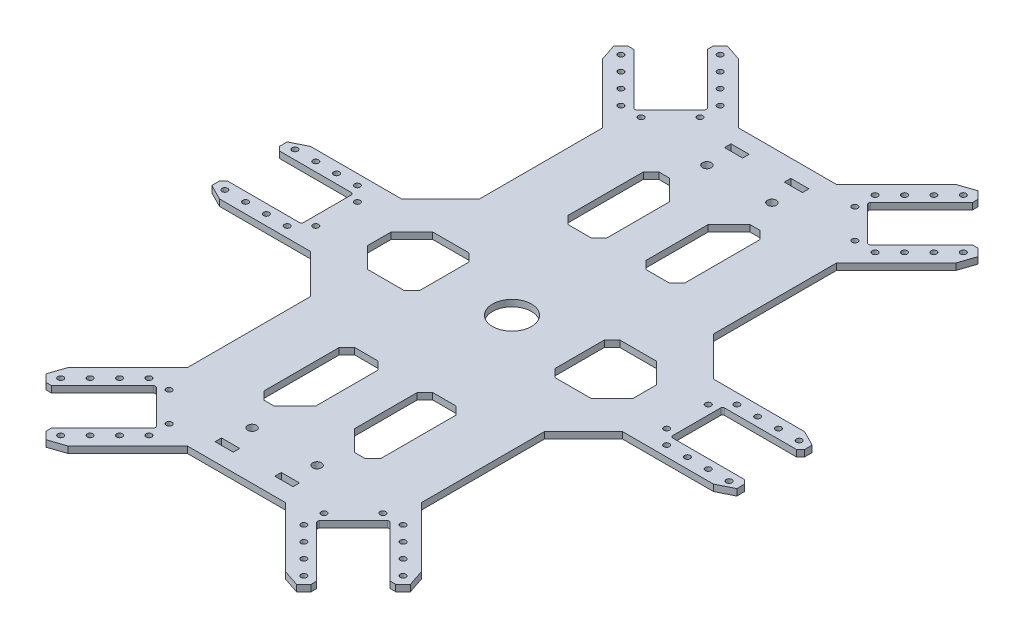
from build123d import *
from OCP.BRepFilletAPI import BRepFilletAPI_MakeChamfer

# Parameters (mm, degrees)
BOSS_EXTRU_1_DEPTH      = 2.5
ENL_V_MAT_EXTRU_1_REACH = 191.513
ESQUISSE2_W             = 24.5
ESQUISSE2_H             = 20
ESQUISSE2_W_2           = 5.5
D_GAGEMENT_M21_D        = 2.2
SYM_TRIE4_OUTLINE_R     = 1.1
SYM_TRIE4_DEPTH         = 2.5
CHANFREIN1_SIZE         = 15
CHANFREIN3_SIZE         = 1.5
CHANFREIN4_SIZE         = 6
CHANFREIN4_SIZE2        = 3
CHANFREIN5_SIZE         = 3
CHANFREIN5_SIZE2        = 6
SYM_TRIE5_DEPTH         = 2.5
SYM_TRIE6_DEPTH         = 2.5
CONG_1_R                = 0.8
ENL_V_MAT_EXTRU_2_REACH = 167.515
ESQUISSE5_R             = 7.5
ESQUISSE5_W             = 7
ESQUISSE5_H             = 2.5
D_GAGEMENT_M31_D        = 3.4


# Read off the part's stored shape, not the designer's step: Symétrie4, Symétrie5, Symétrie6
with BuildPart() as part:
    # Esquisse1 → Boss.-Extru.1 (new body)
    with BuildSketch(Plane(origin=(0, 0, 0), x_dir=(1, 0, 0), z_dir=(0, 1, 0))):
        Polygon((18.837049096, 106), (-18.837049096, 106), (-59.495863992, 146.658814896), (-85.658814896, 120.495863992), (-45, 79.837049096), (-45, 17.5), (-120, 17.5), (-120, -17.5), (-45, -17.5), (-45, -79.837049096), (-85.658814896, -120.495863992), (-59.495863992, -146.658814896), (-18.837049096, -106), (18.837049096, -106), (59.495863992, -146.658814896), (85.658814896, -120.495863992), (45, -79.837049096), (45, -17.5), (120, -17.5), (120, 17.5), (45, 17.5), (45, 79.837049096), (85.658814896, 120.495863992), (59.495863992, 146.658814896), align=None)
    extrude(amount=BOSS_EXTRU_1_DEPTH)

    # Esquisse2 → Enlèv. mat.-Extru.1 (cut, up to next)
    with BuildSketch(Plane(origin=(0, 2.5, 0), x_dir=(1, 0, 0), z_dir=(0, 1, 0)), mode=Mode.PRIVATE) as enl_v_mat_extru_1_sk1:
        Polygon((-48.182155493, 123.324291117), (-62.324291117, 109.182155493), (-45.000174977, 91.858039354), (-30.858039354, 106.000174977), align=None)
    enl_v_mat_extru_1_tool1 = extrude(enl_v_mat_extru_1_sk1.sketch, amount=-ENL_V_MAT_EXTRU_1_REACH, mode=Mode.PRIVATE) & part.part
    # Esquisse2 → Enlèv. mat.-Extru.1 (cut, up to next)
    with BuildSketch(Plane(origin=(0, 2.5, 0), x_dir=(1, 0, 0), z_dir=(0, 1, 0)), mode=Mode.PRIVATE) as enl_v_mat_extru_1_sk2:
        Polygon((-52.071242789, 127.213378413), (-66.213378413, 113.071242789), (-62.324291117, 109.182155493), (-48.182155493, 123.324291117), align=None)
    enl_v_mat_extru_1_tool2 = extrude(enl_v_mat_extru_1_sk2.sketch, amount=-ENL_V_MAT_EXTRU_1_REACH, mode=Mode.PRIVATE) & part.part
    # Esquisse2 → Enlèv. mat.-Extru.1 (cut, up to next)
    with BuildSketch(Plane(origin=(0, 2.5, 0), x_dir=(1, 0, 0), z_dir=(0, 1, 0)), mode=Mode.PRIVATE) as enl_v_mat_extru_1_sk3:
        Polygon((-52.071242789, 127.213378413), (-66.213378413, 113.071242789), (-62.324291117, 109.182155493), (-48.182155493, 123.324291117), align=None)
    enl_v_mat_extru_1_tool3 = extrude(enl_v_mat_extru_1_sk3.sketch, amount=-ENL_V_MAT_EXTRU_1_REACH, mode=Mode.PRIVATE) & part.part
    # Esquisse2 → Enlèv. mat.-Extru.1 (cut, up to next)
    with BuildSketch(Plane(origin=(0, 2.5, 0), x_dir=(1, 0, 0), z_dir=(0, 1, 0)), mode=Mode.PRIVATE) as enl_v_mat_extru_1_sk4:
        with Locations((-83.25, 0)):
            Rectangle(ESQUISSE2_W, ESQUISSE2_H)
    enl_v_mat_extru_1_tool4 = extrude(enl_v_mat_extru_1_sk4.sketch, amount=-ENL_V_MAT_EXTRU_1_REACH, mode=Mode.PRIVATE) & part.part
    # Esquisse2 → Enlèv. mat.-Extru.1 (cut, up to next)
    with BuildSketch(Plane(origin=(0, 2.5, 0), x_dir=(1, 0, 0), z_dir=(0, 1, 0)), mode=Mode.PRIVATE) as enl_v_mat_extru_1_sk5:
        with Locations((-98.25, 0)):
            Rectangle(ESQUISSE2_W_2, ESQUISSE2_H)
    enl_v_mat_extru_1_tool5 = extrude(enl_v_mat_extru_1_sk5.sketch, amount=-ENL_V_MAT_EXTRU_1_REACH, mode=Mode.PRIVATE) & part.part
    # Esquisse2 → Enlèv. mat.-Extru.1 (cut, up to next)
    with BuildSketch(Plane(origin=(0, 2.5, 0), x_dir=(1, 0, 0), z_dir=(0, 1, 0)), mode=Mode.PRIVATE) as enl_v_mat_extru_1_sk6:
        with Locations((-98.25, 0)):
            Rectangle(ESQUISSE2_W_2, ESQUISSE2_H)
    enl_v_mat_extru_1_tool6 = extrude(enl_v_mat_extru_1_sk6.sketch, amount=-ENL_V_MAT_EXTRU_1_REACH, mode=Mode.PRIVATE) & part.part
    # Esquisse2 → Enlèv. mat.-Extru.1 (cut, up to next)
    with BuildSketch(Plane(origin=(0, 2.5, 0), x_dir=(1, 0, 0), z_dir=(0, 1, 0)), mode=Mode.PRIVATE) as enl_v_mat_extru_1_sk7:
        with Locations((-98.25, 0)):
            Rectangle(ESQUISSE2_W_2, ESQUISSE2_H)
    enl_v_mat_extru_1_tool7 = extrude(enl_v_mat_extru_1_sk7.sketch, amount=-ENL_V_MAT_EXTRU_1_REACH, mode=Mode.PRIVATE) & part.part
    # Esquisse2 → Enlèv. mat.-Extru.1 (cut, up to next)
    with BuildSketch(Plane(origin=(0, 2.5, 0), x_dir=(1, 0, 0), z_dir=(0, 1, 0)), mode=Mode.PRIVATE) as enl_v_mat_extru_1_sk8:
        with Locations((-98.25, 0)):
            Rectangle(ESQUISSE2_W_2, ESQUISSE2_H)
    enl_v_mat_extru_1_tool8 = extrude(enl_v_mat_extru_1_sk8.sketch, amount=-ENL_V_MAT_EXTRU_1_REACH, mode=Mode.PRIVATE) & part.part
    # Esquisse2 → Enlèv. mat.-Extru.1 (cut, up to next)
    with BuildSketch(Plane(origin=(0, 2.5, 0), x_dir=(1, 0, 0), z_dir=(0, 1, 0)), mode=Mode.PRIVATE) as enl_v_mat_extru_1_sk9:
        Polygon((-52.071242789, 127.213378413), (-66.213378413, 113.071242789), (-62.324291117, 109.182155493), (-48.182155493, 123.324291117), align=None)
    enl_v_mat_extru_1_tool9 = extrude(enl_v_mat_extru_1_sk9.sketch, amount=-ENL_V_MAT_EXTRU_1_REACH, mode=Mode.PRIVATE) & part.part
    # Esquisse2 → Enlèv. mat.-Extru.1 (cut, up to next)
    with BuildSketch(Plane(origin=(0, 2.5, 0), x_dir=(1, 0, 0), z_dir=(0, 1, 0)), mode=Mode.PRIVATE) as enl_v_mat_extru_1_sk10:
        Polygon((-52.071242789, 127.213378413), (-66.213378413, 113.071242789), (-62.324291117, 109.182155493), (-48.182155493, 123.324291117), align=None)
    enl_v_mat_extru_1_tool10 = extrude(enl_v_mat_extru_1_sk10.sketch, amount=-ENL_V_MAT_EXTRU_1_REACH, mode=Mode.PRIVATE) & part.part
    # Esquisse2 → Enlèv. mat.-Extru.1 (cut, up to next)
    with BuildSketch(Plane(origin=(0, 2.5, 0), x_dir=(1, 0, 0), z_dir=(0, 1, 0)), mode=Mode.PRIVATE) as enl_v_mat_extru_1_sk11:
        Polygon((-101, -10), (-101, 10), (-101, 17.5), (-120, 17.5), (-120, -17.5), (-101, -17.5), align=None)
    enl_v_mat_extru_1_tool11 = extrude(enl_v_mat_extru_1_sk11.sketch, amount=-ENL_V_MAT_EXTRU_1_REACH, mode=Mode.PRIVATE) & part.part
    # Esquisse2 → Enlèv. mat.-Extru.1 (cut, up to next)
    with BuildSketch(Plane(origin=(0, 2.5, 0), x_dir=(1, 0, 0), z_dir=(0, 1, 0)), mode=Mode.PRIVATE) as enl_v_mat_extru_1_sk12:
        Polygon((-66.213378413, 113.071242789), (-52.071242789, 127.213378413), (-46.060835149, 133.223786053), (-59.495863992, 146.658814896), (-85.658814896, 120.495863992), (-72.223786053, 107.060835149), align=None)
    enl_v_mat_extru_1_tool12 = extrude(enl_v_mat_extru_1_sk12.sketch, amount=-ENL_V_MAT_EXTRU_1_REACH, mode=Mode.PRIVATE) & part.part
    enl_v_mat_extru_1_1 = enl_v_mat_extru_1_tool1.solids().sort_by_distance((-46.591165, 2.5, -107.591165))[0]
    add(enl_v_mat_extru_1_1, mode=Mode.SUBTRACT)
    enl_v_mat_extru_1_2 = enl_v_mat_extru_1_tool2.solids().sort_by_distance((-57.197767, 2.5, -118.197767))[0]
    add(enl_v_mat_extru_1_2, mode=Mode.SUBTRACT)
    enl_v_mat_extru_1_3 = enl_v_mat_extru_1_tool3.solids().sort_by_distance((-57.197767, 2.5, -118.197767))[0]
    add(enl_v_mat_extru_1_3, mode=Mode.SUBTRACT)
    enl_v_mat_extru_1_4 = enl_v_mat_extru_1_tool4.solids().sort_by_distance((-83.25, 2.5, 0))[0]
    add(enl_v_mat_extru_1_4, mode=Mode.SUBTRACT)
    enl_v_mat_extru_1_5 = enl_v_mat_extru_1_tool5.solids().sort_by_distance((-98.25, 2.5, 0))[0]
    add(enl_v_mat_extru_1_5, mode=Mode.SUBTRACT)
    enl_v_mat_extru_1_6 = enl_v_mat_extru_1_tool6.solids().sort_by_distance((-98.25, 2.5, 0))[0]
    add(enl_v_mat_extru_1_6, mode=Mode.SUBTRACT)
    enl_v_mat_extru_1_7 = enl_v_mat_extru_1_tool7.solids().sort_by_distance((-98.25, 2.5, 0))[0]
    add(enl_v_mat_extru_1_7, mode=Mode.SUBTRACT)
    enl_v_mat_extru_1_8 = enl_v_mat_extru_1_tool8.solids().sort_by_distance((-98.25, 2.5, 0))[0]
    add(enl_v_mat_extru_1_8, mode=Mode.SUBTRACT)
    enl_v_mat_extru_1_9 = enl_v_mat_extru_1_tool9.solids().sort_by_distance((-57.197767, 2.5, -118.197767))[0]
    add(enl_v_mat_extru_1_9, mode=Mode.SUBTRACT)
    enl_v_mat_extru_1_10 = enl_v_mat_extru_1_tool10.solids().sort_by_distance((-57.197767, 2.5, -118.197767))[0]
    add(enl_v_mat_extru_1_10, mode=Mode.SUBTRACT)
    enl_v_mat_extru_1_11 = enl_v_mat_extru_1_tool11.solids().sort_by_distance((-110.5, 2.5, 0))[0]
    add(enl_v_mat_extru_1_11, mode=Mode.SUBTRACT)
    enl_v_mat_extru_1_12 = enl_v_mat_extru_1_tool12.solids().sort_by_distance((-65.859825, 2.5, -126.859825))[0]
    add(enl_v_mat_extru_1_12, mode=Mode.SUBTRACT)
    enl_v_mat_extru_1 = enl_v_mat_extru_1_1 + enl_v_mat_extru_1_2 + enl_v_mat_extru_1_3 + enl_v_mat_extru_1_4 + enl_v_mat_extru_1_5 + enl_v_mat_extru_1_6 + enl_v_mat_extru_1_7 + enl_v_mat_extru_1_8 + enl_v_mat_extru_1_9 + enl_v_mat_extru_1_10 + enl_v_mat_extru_1_11 + enl_v_mat_extru_1_12  # Enlèv. mat.-Extru.1 as one shape, for the pattern or mirror that repeats it

    # Dégagement M21 (through all)
    with Locations(Plane(origin=(0, 2.5, 0), x_dir=(1, 0, 0), z_dir=(0, 1, 0))):
        with Locations((-67.5, -8), (-73, -13.5), (-81, -13.5), (-89, -13.5), (-97, -13.5), (-67.5, 8), (-73, 13.5), (-81, 13.5), (-89, 13.5), (-97, 13.5), (-41.111087681, 90.797379182), (-48.889262274, 90.797379182), (-54.546116524, 96.454233431), (-60.202970773, 102.111087681), (-65.859825023, 107.76794193), (-29.797379182, 102.111087681), (-29.797379182, 109.889262274), (-35.454233431, 115.546116524), (-41.111087681, 121.202970773), (-46.76794193, 126.859825023)):
            d_gagement_m21 = Hole(D_GAGEMENT_M21_D / 2)

    # Symétrie3: Enlèv. mat.-Extru.1, Dégagement M21 across plane
    add(enl_v_mat_extru_1.mirror(Plane(origin=(0, 0, 0), x_dir=(0, 0, 1), z_dir=(1, 0, 0))), mode=Mode.SUBTRACT)
    add(d_gagement_m21.mirror(Plane(origin=(0, 0, 0), x_dir=(0, 0, 1), z_dir=(1, 0, 0))), mode=Mode.SUBTRACT)

    # Symétrie4 outline → Symétrie4 (cut)
    with BuildSketch(Plane(origin=(0, 0, 0), x_dir=(1, 0, 0), z_dir=(0, 1, 0))):
        Polygon((30.858039354, -106.000174977), (52.071242789, -127.213378413), (46.060835149, -133.223786053), (59.495863992, -146.658814896), (85.658814896, -120.495863992), (72.223786053, -107.060835149), (66.213378413, -113.071242789), (45.000174977, -91.858039354), align=None)
        with Locations((46.76794193, -126.859825023)):
            Circle(SYM_TRIE4_OUTLINE_R)
        with Locations((41.111087681, -121.202970773)):
            Circle(SYM_TRIE4_OUTLINE_R)
        with Locations((35.454233431, -115.546116524)):
            Circle(SYM_TRIE4_OUTLINE_R)
        with Locations((29.797379182, -109.889262274)):
            Circle(SYM_TRIE4_OUTLINE_R)
        with Locations((29.797379182, -102.111087681)):
            Circle(SYM_TRIE4_OUTLINE_R)
        with Locations((65.859825023, -107.76794193)):
            Circle(SYM_TRIE4_OUTLINE_R)
        with Locations((60.202970773, -102.111087681)):
            Circle(SYM_TRIE4_OUTLINE_R)
        with Locations((54.546116524, -96.454233431)):
            Circle(SYM_TRIE4_OUTLINE_R)
        with Locations((48.889262274, -90.797379182)):
            Circle(SYM_TRIE4_OUTLINE_R)
        with Locations((41.111087681, -90.797379182)):
            Circle(SYM_TRIE4_OUTLINE_R)
        Polygon((-46.060835149, -133.223786053), (-52.071242789, -127.213378413), (-30.858039354, -106.000174977), (-45.000174977, -91.858039354), (-66.213378413, -113.071242789), (-72.223786053, -107.060835149), (-85.658814896, -120.495863992), (-59.495863992, -146.658814896), align=None)
        with Locations((-46.76794193, -126.859825023)):
            Circle(SYM_TRIE4_OUTLINE_R)
        with Locations((-41.111087681, -121.202970773)):
            Circle(SYM_TRIE4_OUTLINE_R)
        with Locations((-35.454233431, -115.546116524)):
            Circle(SYM_TRIE4_OUTLINE_R)
        with Locations((-29.797379182, -109.889262274)):
            Circle(SYM_TRIE4_OUTLINE_R)
        with Locations((-29.797379182, -102.111087681)):
            Circle(SYM_TRIE4_OUTLINE_R)
        with Locations((-65.859825023, -107.76794193)):
            Circle(SYM_TRIE4_OUTLINE_R)
        with Locations((-60.202970773, -102.111087681)):
            Circle(SYM_TRIE4_OUTLINE_R)
        with Locations((-54.546116524, -96.454233431)):
            Circle(SYM_TRIE4_OUTLINE_R)
        with Locations((-48.889262274, -90.797379182)):
            Circle(SYM_TRIE4_OUTLINE_R)
        with Locations((-41.111087681, -90.797379182)):
            Circle(SYM_TRIE4_OUTLINE_R)
    extrude(amount=SYM_TRIE4_DEPTH, mode=Mode.SUBTRACT)

    # Chanfrein1
    chanfrein1_edges = [part.edges().sort_by_distance(p)[0] for p in [
        (-45, 1.25, 17.5),
        (-45, 1.25, -17.5),
        (45, 1.25, -17.5),
        (45, 1.25, 17.5),
    ]]
    chamfer(chanfrein1_edges, length=CHANFREIN1_SIZE)

    # Chanfrein3
    chanfrein3_edges = [part.edges().sort_by_distance(p)[0] for p in [
        (-52.071242789, 1.25, -127.213378413),
        (-66.213378413, 1.25, -113.071242789),
        (-101, 1.25, 10),
        (-101, 1.25, -10),
    ]]
    chamfer(chanfrein3_edges, length=CHANFREIN3_SIZE)

    # Chanfrein4: one chamfer whose edges measure the first distance from different faces: ONE call of the kernel's chamfer builder (chamfer() names one face for all edges)
    chanfrein4_edges_1 = [part.edges().sort_by_distance(p)[0] for p in [
        (-72.223786053, 1.25, -107.060835149),
    ]]
    chanfrein4_side_1 = [part.faces().sort_by_distance(p)[0] for p in [
        (-58.611893027, 1.25, -93.448942123),
    ]]
    chanfrein4_edges_2 = [part.edges().sort_by_distance(p)[0] for p in [
        (-101, 1.25, 17.5),
    ]]
    chanfrein4_side_2 = [part.faces().sort_by_distance(p)[0] for p in [
        (-80.5, 1.25, 17.5),
    ]]
    chanfrein4 = BRepFilletAPI_MakeChamfer(part.part.solid().wrapped)
    for e in chanfrein4_edges_1:
        chanfrein4.Add(CHANFREIN4_SIZE, CHANFREIN4_SIZE2, e.wrapped, chanfrein4_side_1[0].wrapped)  # the first distance lies on this face
    for e in chanfrein4_edges_2:
        chanfrein4.Add(CHANFREIN4_SIZE, CHANFREIN4_SIZE2, e.wrapped, chanfrein4_side_2[0].wrapped)  # the first distance lies on this face
    add(Compound.cast(chanfrein4.Shape()), mode=Mode.REPLACE)

    # Chanfrein5: one chamfer whose edges measure the first distance from different faces: ONE call of the kernel's chamfer builder (chamfer() names one face for all edges)
    chanfrein5_edges_1 = [part.edges().sort_by_distance(p)[0] for p in [
        (-46.060835149, 1.25, -133.223786053),
    ]]
    chanfrein5_side_1 = [part.faces().sort_by_distance(p)[0] for p in [
        (-48.535708883, 1.25, -130.748912319),
    ]]
    chanfrein5_edges_2 = [part.edges().sort_by_distance(p)[0] for p in [
        (-101, 1.25, -17.5),
    ]]
    chanfrein5_side_2 = [part.faces().sort_by_distance(p)[0] for p in [
        (-101, 1.25, -14.5),
    ]]
    chanfrein5 = BRepFilletAPI_MakeChamfer(part.part.solid().wrapped)
    for e in chanfrein5_edges_1:
        chanfrein5.Add(CHANFREIN5_SIZE, CHANFREIN5_SIZE2, e.wrapped, chanfrein5_side_1[0].wrapped)  # the first distance lies on this face
    for e in chanfrein5_edges_2:
        chanfrein5.Add(CHANFREIN5_SIZE, CHANFREIN5_SIZE2, e.wrapped, chanfrein5_side_2[0].wrapped)  # the first distance lies on this face
    add(Compound.cast(chanfrein5.Shape()), mode=Mode.REPLACE)

    # Symétrie5 outline → Symétrie5 (cut)
    with BuildSketch(Plane(origin=(0, 0, 0), x_dir=(1, 0, 0), z_dir=(0, 1, 0))):
        Polygon((72.223786053, 107.060835149), (70.10246571, 109.182155492), (67.981145366, 102.818194462), align=None)
        Polygon((65.152718241, 112.010582618), (67.274038585, 112.010582618), (66.213378413, 113.071242789), align=None)
        Polygon((101, -10), (99.5, -10), (101, -11.5), align=None)
        Polygon((101, -17.5), (101, -14.5), (95, -17.5), align=None)
        Polygon((41.818194462, 128.981145366), (48.182155493, 131.10246571), (46.060835149, 133.223786053), align=None)
        Polygon((51.010582618, 128.274038585), (51.010582618, 126.152718241), (52.071242789, 127.213378413), align=None)
        Polygon((95, 17.5), (101, 14.5), (101, 17.5), align=None)
        Polygon((101, 11.5), (99.5, 10), (101, 10), align=None)
    extrude(amount=SYM_TRIE5_DEPTH, mode=Mode.SUBTRACT)

    # Symétrie6 outline → Symétrie6 (cut)
    with BuildSketch(Plane(origin=(0, 0, 0), x_dir=(1, 0, 0), z_dir=(0, 1, 0))):
        Polygon((-41.818194462, -128.981145366), (-48.182155493, -131.10246571), (-46.060835149, -133.223786053), align=None)
        Polygon((-51.010582618, -128.274038585), (-51.010582618, -126.152718241), (-52.071242789, -127.213378413), align=None)
        Polygon((51.010582618, -126.152718241), (51.010582618, -128.274038585), (52.071242789, -127.213378413), align=None)
        Polygon((46.060835149, -133.223786053), (48.182155493, -131.102465709), (41.818194462, -128.981145366), align=None)
        Polygon((-72.223786053, -107.060835149), (-70.10246571, -109.182155492), (-67.981145366, -102.818194462), align=None)
        Polygon((-65.152718241, -112.010582618), (-67.274038585, -112.010582618), (-66.213378413, -113.071242789), align=None)
        Polygon((67.981145366, -102.818194462), (70.10246571, -109.182155493), (72.223786053, -107.060835149), align=None)
        Polygon((67.274038585, -112.010582618), (65.152718241, -112.010582618), (66.213378413, -113.071242789), align=None)
    extrude(amount=SYM_TRIE6_DEPTH, mode=Mode.SUBTRACT)

    # Congé1
    cong_1_edges = [part.edges().sort_by_distance(p)[0] for p in [
        (-30.858039354, 1.25, -106.000174977),
        (-45.000174977, 1.25, -91.858039354),
        (71, 1.25, 10),
        (71, 1.25, -10),
        (30.858039354, 1.25, -106.000174977),
        (45.000174977, 1.25, -91.858039354),
        (30.858039354, 1.25, 106.000174977),
        (45.000174977, 1.25, 91.858039354),
        (-71, 1.25, -10),
        (-71, 1.25, 10),
        (-30.858039354, 1.25, 106.000174977),
        (-45.000174977, 1.25, 91.858039354),
    ]]
    fillet(cong_1_edges, radius=CONG_1_R)

    # Esquisse5 → Enlèv. mat.-Extru.2 (cut, up to next)
    with BuildSketch(Plane(origin=(0, 2.5, 0), x_dir=(1, 0, 0), z_dir=(0, 1, 0)), mode=Mode.PRIVATE) as enl_v_mat_extru_2_sk1:
        with Locations(Location((0, 0, 0), (0, 0, 270))):
            Circle(ESQUISSE5_R)
    enl_v_mat_extru_2_tool1 = extrude(enl_v_mat_extru_2_sk1.sketch, amount=-ENL_V_MAT_EXTRU_2_REACH, mode=Mode.PRIVATE) & part.part
    # Esquisse5 → Enlèv. mat.-Extru.2 (cut, up to next)
    with BuildSketch(Plane(origin=(0, 2.5, 0), x_dir=(1, 0, 0), z_dir=(0, 1, 0)), mode=Mode.PRIVATE) as enl_v_mat_extru_2_sk2:
        Polygon((-43, 12.5), (-29, 12.5), (-26, 9.5), (-26, -9.5), (-29, -12.5), (-43, -12.5), (-51, -4.5), (-51, 4.5), align=None)
    enl_v_mat_extru_2_tool2 = extrude(enl_v_mat_extru_2_sk2.sketch, amount=-ENL_V_MAT_EXTRU_2_REACH, mode=Mode.PRIVATE) & part.part
    # Esquisse5 → Enlèv. mat.-Extru.2 (cut, up to next)
    with BuildSketch(Plane(origin=(0, 2.5, 0), x_dir=(1, 0, 0), z_dir=(0, 1, 0)), mode=Mode.PRIVATE) as enl_v_mat_extru_2_sk3:
        Polygon((-19.5, 76), (-15.5, 76), (-7.5, 68), (-7.5, 44), (-10.5, 41), (-19.5, 41), (-22.5, 44), (-22.5, 73), align=None)
    enl_v_mat_extru_2_tool3 = extrude(enl_v_mat_extru_2_sk3.sketch, amount=-ENL_V_MAT_EXTRU_2_REACH, mode=Mode.PRIVATE) & part.part
    # Esquisse5 → Enlèv. mat.-Extru.2 (cut, up to next)
    with BuildSketch(Plane(origin=(0, 2.5, 0), x_dir=(1, 0, 0), z_dir=(0, 1, 0)), mode=Mode.PRIVATE) as enl_v_mat_extru_2_sk4:
        Polygon((22.5, 73), (19.5, 76), (15.5, 76), (7.5, 68), (7.5, 44), (10.5, 41), (19.5, 41), (22.5, 44), align=None)
    enl_v_mat_extru_2_tool4 = extrude(enl_v_mat_extru_2_sk4.sketch, amount=-ENL_V_MAT_EXTRU_2_REACH, mode=Mode.PRIVATE) & part.part
    # Esquisse5 → Enlèv. mat.-Extru.2 (cut, up to next)
    with BuildSketch(Plane(origin=(0, 2.5, 0), x_dir=(1, 0, 0), z_dir=(0, 1, 0)), mode=Mode.PRIVATE) as enl_v_mat_extru_2_sk5:
        Polygon((29, -12.5), (26, -9.5), (26, 9.5), (29, 12.5), (43, 12.5), (51, 4.5), (51, -4.5), (43, -12.5), align=None)
    enl_v_mat_extru_2_tool5 = extrude(enl_v_mat_extru_2_sk5.sketch, amount=-ENL_V_MAT_EXTRU_2_REACH, mode=Mode.PRIVATE) & part.part
    # Esquisse5 → Enlèv. mat.-Extru.2 (cut, up to next)
    with BuildSketch(Plane(origin=(0, 2.5, 0), x_dir=(1, 0, 0), z_dir=(0, 1, 0)), mode=Mode.PRIVATE) as enl_v_mat_extru_2_sk6:
        Polygon((19.5, -76), (15.5, -76), (7.5, -68), (7.5, -44), (10.5, -41), (19.5, -41), (22.5, -44), (22.5, -73), align=None)
    enl_v_mat_extru_2_tool6 = extrude(enl_v_mat_extru_2_sk6.sketch, amount=-ENL_V_MAT_EXTRU_2_REACH, mode=Mode.PRIVATE) & part.part
    # Esquisse5 → Enlèv. mat.-Extru.2 (cut, up to next)
    with BuildSketch(Plane(origin=(0, 2.5, 0), x_dir=(1, 0, 0), z_dir=(0, 1, 0)), mode=Mode.PRIVATE) as enl_v_mat_extru_2_sk7:
        Polygon((-22.5, -73), (-19.5, -76), (-15.5, -76), (-7.5, -68), (-7.5, -44), (-10.5, -41), (-19.5, -41), (-22.5, -44), align=None)
    enl_v_mat_extru_2_tool7 = extrude(enl_v_mat_extru_2_sk7.sketch, amount=-ENL_V_MAT_EXTRU_2_REACH, mode=Mode.PRIVATE) & part.part
    # Esquisse5 → Enlèv. mat.-Extru.2 (cut, up to next)
    with BuildSketch(Plane(origin=(0, 2.5, 0), x_dir=(1, 0, 0), z_dir=(0, 1, 0)), mode=Mode.PRIVATE) as enl_v_mat_extru_2_sk8:
        with Locations((-11.5, -98)):
            Rectangle(ESQUISSE5_W, ESQUISSE5_H)
    enl_v_mat_extru_2_tool8 = extrude(enl_v_mat_extru_2_sk8.sketch, amount=-ENL_V_MAT_EXTRU_2_REACH, mode=Mode.PRIVATE) & part.part
    # Esquisse5 → Enlèv. mat.-Extru.2 (cut, up to next)
    with BuildSketch(Plane(origin=(0, 2.5, 0), x_dir=(1, 0, 0), z_dir=(0, 1, 0)), mode=Mode.PRIVATE) as enl_v_mat_extru_2_sk9:
        with Locations((11.5, -98)):
            Rectangle(ESQUISSE5_W, ESQUISSE5_H)
    enl_v_mat_extru_2_tool9 = extrude(enl_v_mat_extru_2_sk9.sketch, amount=-ENL_V_MAT_EXTRU_2_REACH, mode=Mode.PRIVATE) & part.part
    # Esquisse5 → Enlèv. mat.-Extru.2 (cut, up to next)
    with BuildSketch(Plane(origin=(0, 2.5, 0), x_dir=(1, 0, 0), z_dir=(0, 1, 0)), mode=Mode.PRIVATE) as enl_v_mat_extru_2_sk10:
        with Locations((11.5, 98)):
            Rectangle(ESQUISSE5_W, ESQUISSE5_H)
    enl_v_mat_extru_2_tool10 = extrude(enl_v_mat_extru_2_sk10.sketch, amount=-ENL_V_MAT_EXTRU_2_REACH, mode=Mode.PRIVATE) & part.part
    # Esquisse5 → Enlèv. mat.-Extru.2 (cut, up to next)
    with BuildSketch(Plane(origin=(0, 2.5, 0), x_dir=(1, 0, 0), z_dir=(0, 1, 0)), mode=Mode.PRIVATE) as enl_v_mat_extru_2_sk11:
        with Locations((-11.5, 98)):
            Rectangle(ESQUISSE5_W, ESQUISSE5_H)
    enl_v_mat_extru_2_tool11 = extrude(enl_v_mat_extru_2_sk11.sketch, amount=-ENL_V_MAT_EXTRU_2_REACH, mode=Mode.PRIVATE) & part.part
    add(enl_v_mat_extru_2_tool1.solids().sort_by_distance((0, 2.5, 0))[0], mode=Mode.SUBTRACT)
    add(enl_v_mat_extru_2_tool2.solids().sort_by_distance((-37.547403, 2.5, 0))[0], mode=Mode.SUBTRACT)
    add(enl_v_mat_extru_2_tool3.solids().sort_by_distance((-15.261557, 2.5, -57.664929))[0], mode=Mode.SUBTRACT)
    add(enl_v_mat_extru_2_tool4.solids().sort_by_distance((15.261557, 2.5, -57.664929))[0], mode=Mode.SUBTRACT)
    add(enl_v_mat_extru_2_tool5.solids().sort_by_distance((37.547403, 2.5, 0))[0], mode=Mode.SUBTRACT)
    add(enl_v_mat_extru_2_tool6.solids().sort_by_distance((15.261557, 2.5, 57.664929))[0], mode=Mode.SUBTRACT)
    add(enl_v_mat_extru_2_tool7.solids().sort_by_distance((-15.261557, 2.5, 57.664929))[0], mode=Mode.SUBTRACT)
    add(enl_v_mat_extru_2_tool8.solids().sort_by_distance((-11.5, 2.5, 98))[0], mode=Mode.SUBTRACT)
    add(enl_v_mat_extru_2_tool9.solids().sort_by_distance((11.5, 2.5, 98))[0], mode=Mode.SUBTRACT)
    add(enl_v_mat_extru_2_tool10.solids().sort_by_distance((11.5, 2.5, -98))[0], mode=Mode.SUBTRACT)
    add(enl_v_mat_extru_2_tool11.solids().sort_by_distance((-11.5, 2.5, -98))[0], mode=Mode.SUBTRACT)

    # Dégagement M31 (through all)
    with Locations(Plane(origin=(0, 2.5, 0), x_dir=(1, 0, 0), z_dir=(0, 1, 0))):
        with Locations((-12.5, 87.5), (12.5, 87.5), (12.5, -87.5), (-12.5, -87.5)):
            Hole(D_GAGEMENT_M31_D / 2)


solid = part.part
